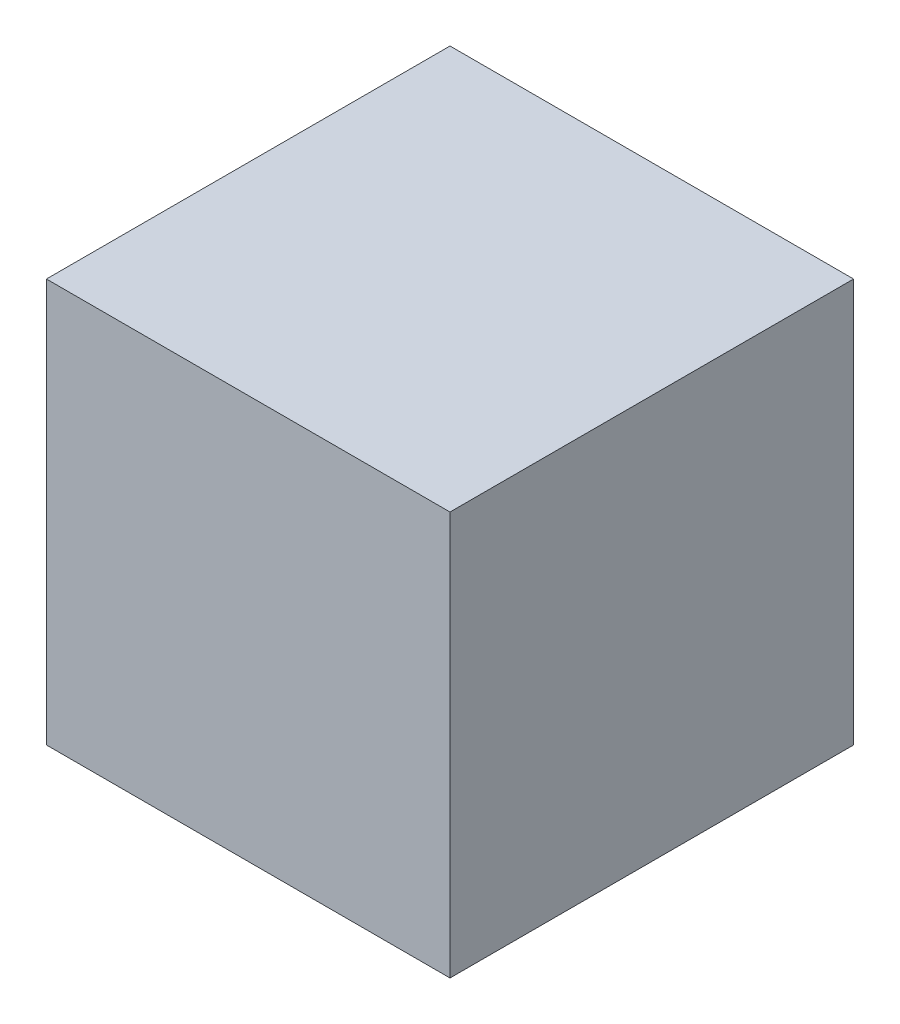
from build123d import *

# Parameters (mm, degrees)
SKETCH_1_W      = 100
SKETCH_1_H      = 100
EXTRUDE_1_DEPTH = 100


with BuildPart() as part:
    # 草图1 → 凸台-拉伸1 (new body)
    with BuildSketch(Plane.XY):
        with Locations((-2.830188679, -12.264150943)):
            Rectangle(SKETCH_1_W, SKETCH_1_H)
    extrude(amount=EXTRUDE_1_DEPTH)


solid = part.part
